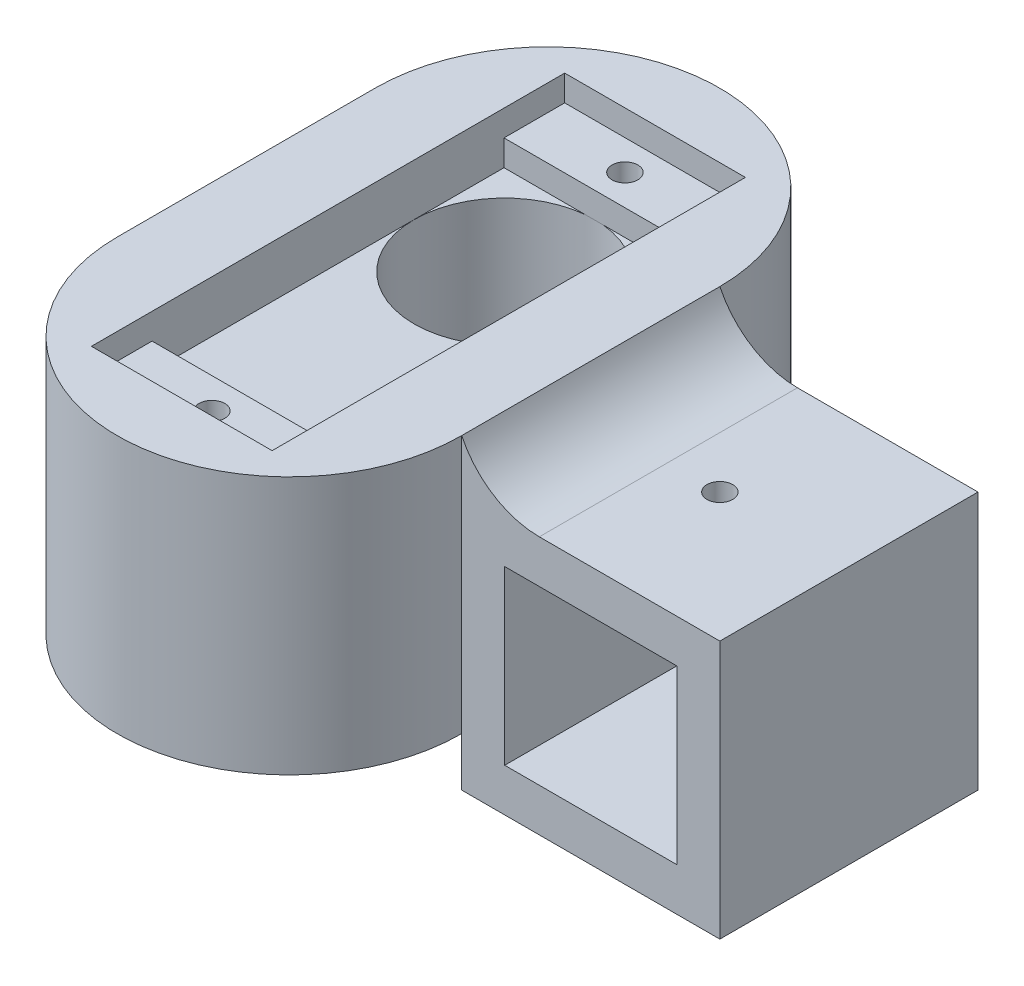
from build123d import *

# Parameters (mm, degrees)
SKETCH1_W           = 30
SKETCH1_H           = 30
SKETCH1_W_2         = 20
SKETCH1_H_2         = 20
BOSS_EXTRUDE2_DEPTH = 30
BOSS_EXTRUDE3_DEPTH = 30
SKETCH6_W           = 21
SKETCH6_H           = 55
CUT_EXTRUDE1_DEPTH  = 3
SKETCH7_R           = 1.5
CUT_EXTRUDE2_DEPTH  = 5
SKETCH8_W           = 21
SKETCH8_H           = 40.9
CUT_EXTRUDE3_DEPTH  = 3
SKETCH9_R           = 10.5
CUT_EXTRUDE4_DEPTH  = 81.056214629
BOSS_EXTRUDE4_START = -10
SKETCH10_R          = 10.5
SKETCH10_R_2        = 4
BOSS_EXTRUDE4_DEPTH = 10
FILLET1_R           = 10
SKETCH11_R          = 1.5
CUT_EXTRUDE5_DEPTH  = 81.175402093


with BuildPart() as part:
    # Sketch1 → Boss-Extrude2 (new body)
    with BuildSketch(Plane.XY):
        Rectangle(SKETCH1_W, SKETCH1_H)
        Rectangle(SKETCH1_W_2, SKETCH1_H_2, mode=Mode.SUBTRACT)
    extrude(amount=BOSS_EXTRUDE2_DEPTH)

    # Sketch5 → Boss-Extrude3 (add)
    with BuildSketch(Plane(origin=(0, 20.68, 0), x_dir=(1, 0, 0), z_dir=(0, 1, 0))):
        with BuildLine():
            Line((-15, -30.030941434), (-15, -0.030941434))
            ThreePointArc((-15, -0.030941434), (-35, 19.969058566), (-55, -0.030941434))
            Line((-55, -0.030941434), (-55, -30.030941434))
            ThreePointArc((-55, -30.030941434), (-35, -50.030941434), (-15, -30.030941434))
        make_face()
    extrude(amount=-BOSS_EXTRUDE3_DEPTH)

    # Sketch6 → Cut-Extrude1 (cut)
    with BuildSketch(Plane(origin=(0, 20.68, 0), x_dir=(1, 0, 0), z_dir=(0, 1, 0))):
        with Locations((-35, -15.030941434)):
            Rectangle(SKETCH6_W, SKETCH6_H)
    extrude(amount=-CUT_EXTRUDE1_DEPTH, mode=Mode.SUBTRACT)

    # Sketch7 → Cut-Extrude2 (cut)
    with BuildSketch(Plane(origin=(0, 17.68, 0), x_dir=(1, 0, 0), z_dir=(0, 1, 0))):
        with Locations(Location((-35, -39.030941434, 0), (0, 0, 270))):
            Circle(SKETCH7_R)
        with Locations(Location((-35, 8.969058566, 0), (0, 0, 270))):
            Circle(SKETCH7_R)
    extrude(amount=-CUT_EXTRUDE2_DEPTH, mode=Mode.SUBTRACT)

    # Sketch8 → Cut-Extrude3 (cut)
    with BuildSketch(Plane(origin=(0, 17.68, 0), x_dir=(1, 0, 0), z_dir=(0, 1, 0))):
        with Locations((-35, -15.030941434)):
            Rectangle(SKETCH8_W, SKETCH8_H)
    extrude(amount=-CUT_EXTRUDE3_DEPTH, mode=Mode.SUBTRACT)

    # Sketch9 → Cut-Extrude4 (cut, through all)
    with BuildSketch(Plane(origin=(0, 14.68, 0), x_dir=(1, 0, 0), z_dir=(0, 1, 0))):
        with Locations(Location((-35, -5.030941434, 0), (0, 0, 180))):
            Circle(SKETCH9_R)
    extrude(amount=-CUT_EXTRUDE4_DEPTH, mode=Mode.SUBTRACT)

    # Sketch10 → Boss-Extrude4 (add)
    with BuildSketch(Plane.XZ.offset(9.32).offset(BOSS_EXTRUDE4_START)):
        with Locations(Location((-35, 5.030941434, 0), (0, 0, 180))):
            Circle(SKETCH10_R)
        with Locations(Location((-35, 5.030941434, 0), (0, 0, 270))):
            Circle(SKETCH10_R_2, mode=Mode.SUBTRACT)
    extrude(amount=BOSS_EXTRUDE4_DEPTH)

    # Fillet1
    # the kernel refuses this fillet: 10 mm, written as the material it adds along each edge
    with BuildSketch(Plane(origin=(-15, 15, -22.515898699), x_dir=(1, 0, 0), z_dir=(0, 0, 1))) as fillet1_piece_1_section:
        with BuildLine():
            CenterArc((9.018736053, 10), FILLET1_R, 205.594552278, 64.405447722)
            Line((0, 5.68), (0, 0))
            Line((0, 0), (9.018736053, 0))
        make_face()
    fillet1_piece_1 = extrude(amount=52.515898699, mode=Mode.PRIVATE)
    fillet1_piece_1 = split(fillet1_piece_1, bisect_by=Plane(origin=(-11.321087315, 16.521398323, 0), z_dir=(0, 0, 1)), keep=Keep.TOP, mode=Mode.PRIVATE)
    add(fillet1_piece_1)

    # Sketch11 → Cut-Extrude5 (cut, through all)
    with BuildSketch(Plane(origin=(0, 15, 0), x_dir=(1, 0, 0), z_dir=(0, 1, 0))):
        with Locations(Location((0, -15, 0), (0, 0, 270))):
            Circle(SKETCH11_R)
    extrude(amount=-CUT_EXTRUDE5_DEPTH, mode=Mode.SUBTRACT)


solid = part.part
